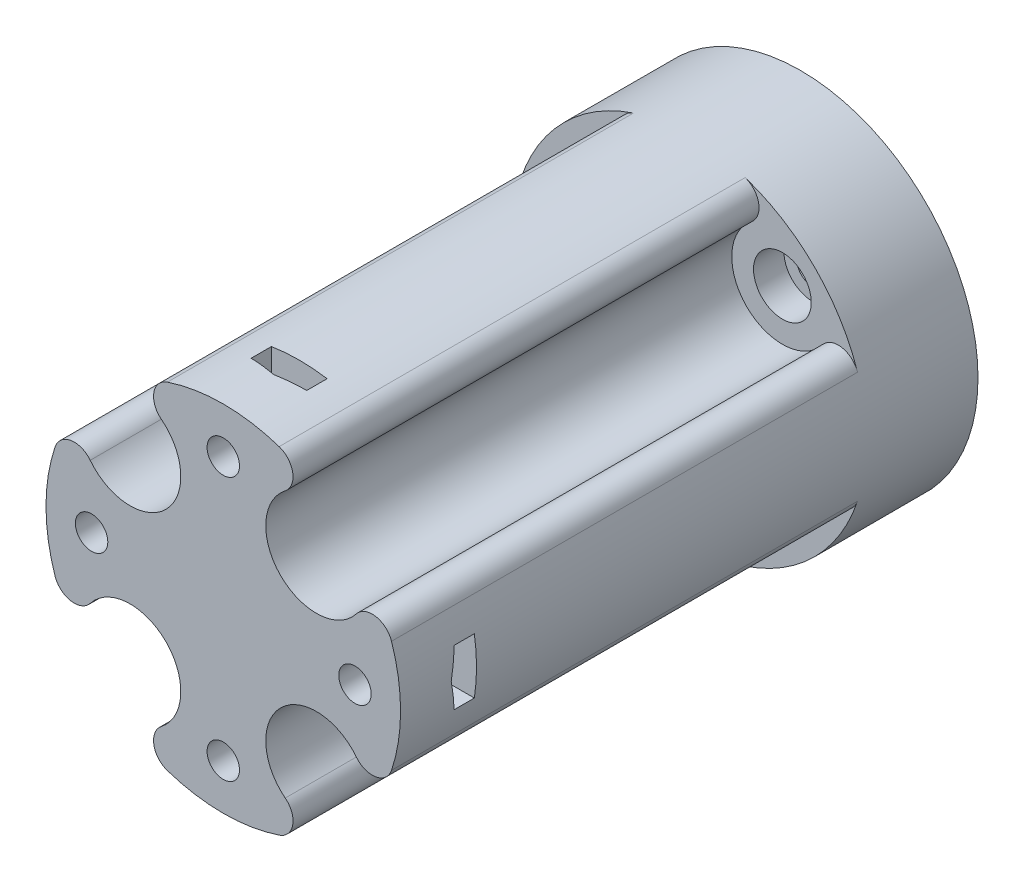
from build123d import *

# Parameters (mm, degrees)
SKETCH1_R           = 17.5
SKETCH1_R_2         = 2.85
BOSS_EXTRUDE1_DEPTH = 57
SKETCH1_3_R         = 2.85
SKETCH1_3_R_2       = 1.6
BOSS_EXTRUDE2_DEPTH = 8
SKETCH2_R           = 5
CUT_EXTRUDE1_DEPTH  = 46
FILLET1_R           = 2
CUT_EXTRUDE2_START  = -7.5
SKETCH3_R           = 1.6
CUT_EXTRUDE2_DEPTH  = 2.5
CUT_EXTRUDE3_START  = -10
SKETCH3_2_R         = 1.6
CUT_EXTRUDE3_DEPTH  = 10
CHAMFER1_SIZE       = 2.75
CHAMFER1_SIZE_2     = 0.5


with BuildPart() as part:
    # Sketch1 → Boss-Extrude1 (new body)
    with BuildSketch(Plane(origin=(0, 0, 0), x_dir=(0, 1, 0), z_dir=(0, 0, 1))):
        with Locations(Location((0, 0, 0), (0, 0, 90))):
            Circle(SKETCH1_R)
        with Locations(Location((-9.192388155, 9.192388155, 0), (0, 0, 90))):
            Circle(SKETCH1_R_2, mode=Mode.SUBTRACT)
        with Locations(Location((-9.192388155, -9.192388155, 0), (0, 0, 90))):
            Circle(SKETCH1_R_2, mode=Mode.SUBTRACT)
        with Locations(Location((9.192388155, -9.192388155, 0), (0, 0, 90))):
            Circle(SKETCH1_R_2, mode=Mode.SUBTRACT)
        with Locations(Location((9.192388155, 9.192388155, 0), (0, 0, 90))):
            Circle(SKETCH1_R_2, mode=Mode.SUBTRACT)
    extrude(amount=BOSS_EXTRUDE1_DEPTH)

    # Sketch1<3> → Boss-Extrude2 (add)
    # profile 1 of 4: a face of its own
    with BuildSketch(Plane(origin=(0, 0, 0), x_dir=(0, 1, 0), z_dir=(0, 0, 1))):
        with Locations(Location((-9.192388155, -9.192388155, 0), (0, 0, 90))):
            Circle(SKETCH1_3_R)
        with Locations(Location((-9.192388155, -9.192388155, 0), (0, 0, 270))):
            Circle(SKETCH1_3_R_2, mode=Mode.SUBTRACT)
    # profile 2 of 4: a face of its own
    with BuildSketch(Plane(origin=(0, 0, 0), x_dir=(0, 1, 0), z_dir=(0, 0, 1))):
        with Locations(Location((-9.192388155, 9.192388155, 0), (0, 0, 90))):
            Circle(SKETCH1_3_R)
        with Locations(Location((-9.192388155, 9.192388155, 0), (0, 0, 270))):
            Circle(SKETCH1_3_R_2, mode=Mode.SUBTRACT)
    # profile 3 of 4: a face of its own
    with BuildSketch(Plane(origin=(0, 0, 0), x_dir=(0, 1, 0), z_dir=(0, 0, 1))):
        with Locations(Location((9.192388155, -9.192388155, 0), (0, 0, 90))):
            Circle(SKETCH1_3_R)
        with Locations(Location((9.192388155, -9.192388155, 0), (0, 0, 270))):
            Circle(SKETCH1_3_R_2, mode=Mode.SUBTRACT)
    # profile 4 of 4: a face of its own
    with BuildSketch(Plane(origin=(0, 0, 0), x_dir=(0, 1, 0), z_dir=(0, 0, 1))):
        with Locations(Location((9.192388155, 9.192388155, 0), (0, 0, 90))):
            Circle(SKETCH1_3_R)
        with Locations(Location((9.192388155, 9.192388155, 0), (0, 0, 270))):
            Circle(SKETCH1_3_R_2, mode=Mode.SUBTRACT)
    extrude(amount=BOSS_EXTRUDE2_DEPTH)

    # Sketch2 → Cut-Extrude1 (cut)
    with BuildSketch(Plane.XY.offset(57)):
        with Locations((-9.192388155, 9.192388155)):
            Circle(SKETCH2_R)
        with Locations((9.192388155, 9.192388155)):
            Circle(SKETCH2_R)
        with Locations((9.192388155, -9.192388155)):
            Circle(SKETCH2_R)
        with Locations((-9.192388155, -9.192388155)):
            Circle(SKETCH2_R)
    extrude(amount=-CUT_EXTRUDE1_DEPTH, mode=Mode.SUBTRACT)

    # Fillet1
    fillet1_edges = [part.edges().sort_by_distance(p)[0] for p in [
        (-14.028560913, -10.46181049, 34),
        (-10.46181049, -14.028560913, 34),
        (10.46181049, -14.028560913, 34),
        (14.028560913, -10.46181049, 34),
        (14.028560913, 10.46181049, 34),
        (10.46181049, 14.028560913, 34),
        (-10.46181049, 14.028560913, 34),
        (-14.028560913, 10.46181049, 34),
    ]]
    fillet(fillet1_edges, radius=FILLET1_R)

    # Sketch3 → Cut-Extrude2 (cut)
    # profile 1 of 4: a face of its own
    with BuildSketch(Plane.XY.offset(57).offset(CUT_EXTRUDE2_START)):
        with BuildLine():
            Line((-2.75, 15.75), (-2.75, 17.282577933))
            ThreePointArc((-2.75, 17.282577933), (0, 17.5), (2.75, 17.282577933))
            Line((2.75, 17.282577933), (2.75, 15.75))
            Line((2.75, 15.75), (2.75, 10.25))
            Line((2.75, 10.25), (-2.75, 10.25))
            Line((-2.75, 10.25), (-2.75, 15.75))
        make_face()
        with Locations((0, 13)):
            Circle(SKETCH3_R, mode=Mode.SUBTRACT)
    # profile 2 of 4: a face of its own
    with BuildSketch(Plane.XY.offset(57).offset(CUT_EXTRUDE2_START)):
        with BuildLine():
            Line((15.75, -2.75), (10.25, -2.75))
            Line((10.25, -2.75), (10.25, 2.75))
            Line((10.25, 2.75), (15.75, 2.75))
            Line((15.75, 2.75), (17.282577933, 2.75))
            ThreePointArc((17.282577933, 2.75), (17.5, 0), (17.282577933, -2.75))
            Line((17.282577933, -2.75), (15.75, -2.75))
        make_face()
        with Locations((13, 0)):
            Circle(SKETCH3_R, mode=Mode.SUBTRACT)
    # profile 3 of 4: a face of its own
    with BuildSketch(Plane.XY.offset(57).offset(CUT_EXTRUDE2_START)):
        with BuildLine():
            Line((-2.75, -15.75), (-2.75, -10.25))
            Line((-2.75, -10.25), (2.75, -10.25))
            Line((2.75, -10.25), (2.75, -15.75))
            Line((2.75, -15.75), (2.75, -17.282577933))
            ThreePointArc((2.75, -17.282577933), (0, -17.5), (-2.75, -17.282577933))
            Line((-2.75, -17.282577933), (-2.75, -15.75))
        make_face()
        with Locations((0, -13)):
            Circle(SKETCH3_R, mode=Mode.SUBTRACT)
    # profile 4 of 4: a face of its own
    with BuildSketch(Plane.XY.offset(57).offset(CUT_EXTRUDE2_START)):
        with BuildLine():
            Line((-15.75, 2.75), (-10.25, 2.75))
            Line((-10.25, 2.75), (-10.25, -2.75))
            Line((-10.25, -2.75), (-15.75, -2.75))
            Line((-15.75, -2.75), (-17.282577933, -2.75))
            ThreePointArc((-17.282577933, -2.75), (-17.5, 0), (-17.282577933, 2.75))
            Line((-17.282577933, 2.75), (-15.75, 2.75))
        make_face()
        with Locations((-13, 0)):
            Circle(SKETCH3_R, mode=Mode.SUBTRACT)
    extrude(amount=CUT_EXTRUDE2_DEPTH, mode=Mode.SUBTRACT)

    # Sketch3<2> → Cut-Extrude3 (cut)
    with BuildSketch(Plane.XY.offset(57).offset(CUT_EXTRUDE3_START)):
        with Locations((-13, 0)):
            Circle(SKETCH3_2_R)
        with Locations((0, 13)):
            Circle(SKETCH3_2_R)
        with Locations((13, 0)):
            Circle(SKETCH3_2_R)
        with Locations((0, -13)):
            Circle(SKETCH3_2_R)
    extrude(amount=CUT_EXTRUDE3_DEPTH, mode=Mode.SUBTRACT)

    # Chamfer1
    # the kernel refuses this chamfer: 2.75, 0.5 mm, written as the material it adds along each edge
    with BuildSketch(Plane(origin=(-3.104266441, -2.75, 52), x_dir=(1.0355932807417332e-14, 0.9999763028084744, 0.006884317068104265), z_dir=(-1, 0, 0))) as chamfer1_piece_1_section:
        Polygon((CHAMFER1_SIZE * 0.999976302808, CHAMFER1_SIZE * 0.0068843170681), (-CHAMFER1_SIZE_2 * 0.0068843170681, CHAMFER1_SIZE_2 * 0.999976302808), (0, 0), align=None)
    chamfer1_piece_1 = extrude(amount=21.324045051, mode=Mode.PRIVATE)
    chamfer1_piece_1 = chamfer1_piece_1 & Plane(origin=(0, 0, 51.863927103), x_dir=(-1, 0, 0), z_dir=(0, 0, -1)) * Cylinder(17.5, 54, mode=Mode.PRIVATE)
    chamfer1_piece_1 = chamfer1_piece_1 - Plane(origin=(-13, 0, 51.863927103), x_dir=(1, 0, 0), z_dir=(0, 0, -1)) * Cylinder(1.6, 54, mode=Mode.PRIVATE)
    add(chamfer1_piece_1)
    with BuildSketch(Plane(origin=(-24.428311492, 2.75, 52), x_dir=(-1.048222467092242e-14, -0.9999763028084744, 0.006884317068104265), z_dir=(1, 0, 0))) as chamfer1_piece_2_section:
        Polygon((CHAMFER1_SIZE * 0.999976302808, CHAMFER1_SIZE * 0.0068843170681), (-CHAMFER1_SIZE_2 * 0.0068843170681, CHAMFER1_SIZE_2 * 0.999976302808), (0, 0), align=None)
    chamfer1_piece_2 = extrude(amount=21.324045051, mode=Mode.PRIVATE)
    chamfer1_piece_2 = chamfer1_piece_2 & Plane(origin=(0, 0, 51.852070579), x_dir=(-1, 0, 0), z_dir=(0, 0, -1)) * Cylinder(17.5, 54, mode=Mode.PRIVATE)
    chamfer1_piece_2 = chamfer1_piece_2 - Plane(origin=(-13, 0, 51.852070579), x_dir=(1, 0, 0), z_dir=(0, 0, -1)) * Cylinder(1.6, 54, mode=Mode.PRIVATE)
    add(chamfer1_piece_2)
    with BuildSketch(Plane(origin=(-2.75, 3.104266441, 52), x_dir=(0.9999763028084744, 0, 0.006884317068104265), z_dir=(0, 1, 0))) as chamfer1_piece_3_section:
        Polygon((CHAMFER1_SIZE * 0.999976302808, CHAMFER1_SIZE * 0.0068843170681), (-CHAMFER1_SIZE_2 * 0.0068843170681, CHAMFER1_SIZE_2 * 0.999976302808), (0, 0), align=None)
    chamfer1_piece_3 = extrude(amount=21.324045051, mode=Mode.PRIVATE)
    chamfer1_piece_3 = chamfer1_piece_3 & Plane(origin=(0, 0, 51.863927103), x_dir=(-1, 0, 0), z_dir=(0, 0, -1)) * Cylinder(17.5, 54, mode=Mode.PRIVATE)
    chamfer1_piece_3 = chamfer1_piece_3 - Plane(origin=(0, 13, 51.863927103), x_dir=(1, 0, 0), z_dir=(0, 0, -1)) * Cylinder(1.6, 54, mode=Mode.PRIVATE)
    add(chamfer1_piece_3)
    with BuildSketch(Plane(origin=(2.75, 24.428311492, 52), x_dir=(0.20388124945923355, 0, -0.9789956262001082), z_dir=(0, -1, 0))) as chamfer1_piece_4_section:
        Polygon((CHAMFER1_SIZE_2 * 0.9789956262, -CHAMFER1_SIZE_2 * 0.203881249459), (-CHAMFER1_SIZE * 0.203881249459, -CHAMFER1_SIZE * 0.9789956262), (0, 0), align=None)
    chamfer1_piece_4 = extrude(amount=21.324045051, mode=Mode.PRIVATE)
    chamfer1_piece_4 = chamfer1_piece_4 & Plane(origin=(0, 0, 51.852070749), x_dir=(-1, 0, 0), z_dir=(0, 0, -1)) * Cylinder(17.5, 54, mode=Mode.PRIVATE)
    chamfer1_piece_4 = chamfer1_piece_4 - Plane(origin=(0, 13, 51.852070749), x_dir=(1, 0, 0), z_dir=(0, 0, -1)) * Cylinder(1.6, 54, mode=Mode.PRIVATE)
    add(chamfer1_piece_4)
    with BuildSketch(Plane(origin=(3.104266441, 2.75, 52), x_dir=(-3.409880314637416e-15, -0.9999763028084744, 0.006884317068104265), z_dir=(1, 0, 0))) as chamfer1_piece_5_section:
        Polygon((CHAMFER1_SIZE * 0.999976302808, CHAMFER1_SIZE * 0.0068843170681), (-CHAMFER1_SIZE_2 * 0.0068843170681, CHAMFER1_SIZE_2 * 0.999976302808), (0, 0), align=None)
    chamfer1_piece_5 = extrude(amount=21.324045051, mode=Mode.PRIVATE)
    chamfer1_piece_5 = chamfer1_piece_5 & Plane(origin=(0, 0, 51.863927103), x_dir=(-1, 0, 0), z_dir=(0, 0, -1)) * Cylinder(17.5, 54, mode=Mode.PRIVATE)
    chamfer1_piece_5 = chamfer1_piece_5 - Plane(origin=(13, 0, 51.863927103), x_dir=(1, 0, 0), z_dir=(0, 0, -1)) * Cylinder(1.6, 54, mode=Mode.PRIVATE)
    add(chamfer1_piece_5)
    with BuildSketch(Plane(origin=(24.428311492, -2.75, 52), x_dir=(0, -0.20388124945923355, -0.9789956262001082), z_dir=(-1, 0, 0))) as chamfer1_piece_6_section:
        Polygon((CHAMFER1_SIZE_2 * 0.9789956262, -CHAMFER1_SIZE_2 * 0.203881249459), (-CHAMFER1_SIZE * 0.203881249459, -CHAMFER1_SIZE * 0.9789956262), (0, 0), align=None)
    chamfer1_piece_6 = extrude(amount=21.324045051, mode=Mode.PRIVATE)
    chamfer1_piece_6 = chamfer1_piece_6 & Plane(origin=(0, 0, 51.852070888), x_dir=(-1, 0, 0), z_dir=(0, 0, -1)) * Cylinder(17.5, 54, mode=Mode.PRIVATE)
    chamfer1_piece_6 = chamfer1_piece_6 - Plane(origin=(13, 0, 51.852070888), x_dir=(1, 0, 0), z_dir=(0, 0, -1)) * Cylinder(1.6, 54, mode=Mode.PRIVATE)
    add(chamfer1_piece_6)
    with BuildSketch(Plane(origin=(2.75, -3.104266441, 52), x_dir=(-0.9999763028084744, 6.88290656102737e-15, 0.006884317068104265), z_dir=(0, -1, 0))) as chamfer1_piece_7_section:
        Polygon((CHAMFER1_SIZE * 0.999976302808, CHAMFER1_SIZE * 0.0068843170681), (-CHAMFER1_SIZE_2 * 0.0068843170681, CHAMFER1_SIZE_2 * 0.999976302808), (0, 0), align=None)
    chamfer1_piece_7 = extrude(amount=21.324045051, mode=Mode.PRIVATE)
    chamfer1_piece_7 = chamfer1_piece_7 & Plane(origin=(0, 0, 51.863927103), x_dir=(-1, 0, 0), z_dir=(0, 0, -1)) * Cylinder(17.5, 54, mode=Mode.PRIVATE)
    chamfer1_piece_7 = chamfer1_piece_7 - Plane(origin=(0, -13, 51.863927103), x_dir=(1, 0, 0), z_dir=(0, 0, -1)) * Cylinder(1.6, 54, mode=Mode.PRIVATE)
    add(chamfer1_piece_7)
    with BuildSketch(Plane(origin=(-2.75, -24.428311492, 52), x_dir=(-0.20388124945923355, 1.4290779976363847e-15, -0.9789956262001082), z_dir=(0, 1, 0))) as chamfer1_piece_8_section:
        Polygon((CHAMFER1_SIZE_2 * 0.9789956262, -CHAMFER1_SIZE_2 * 0.203881249459), (-CHAMFER1_SIZE * 0.203881249459, -CHAMFER1_SIZE * 0.9789956262), (0, 0), align=None)
    chamfer1_piece_8 = extrude(amount=21.324045051, mode=Mode.PRIVATE)
    chamfer1_piece_8 = chamfer1_piece_8 & Plane(origin=(0, 0, 51.852070422), x_dir=(-1, 0, 0), z_dir=(0, 0, -1)) * Cylinder(17.5, 54, mode=Mode.PRIVATE)
    chamfer1_piece_8 = chamfer1_piece_8 - Plane(origin=(0, -13, 51.852070422), x_dir=(1, 0, 0), z_dir=(0, 0, -1)) * Cylinder(1.6, 54, mode=Mode.PRIVATE)
    add(chamfer1_piece_8)


solid = part.part
